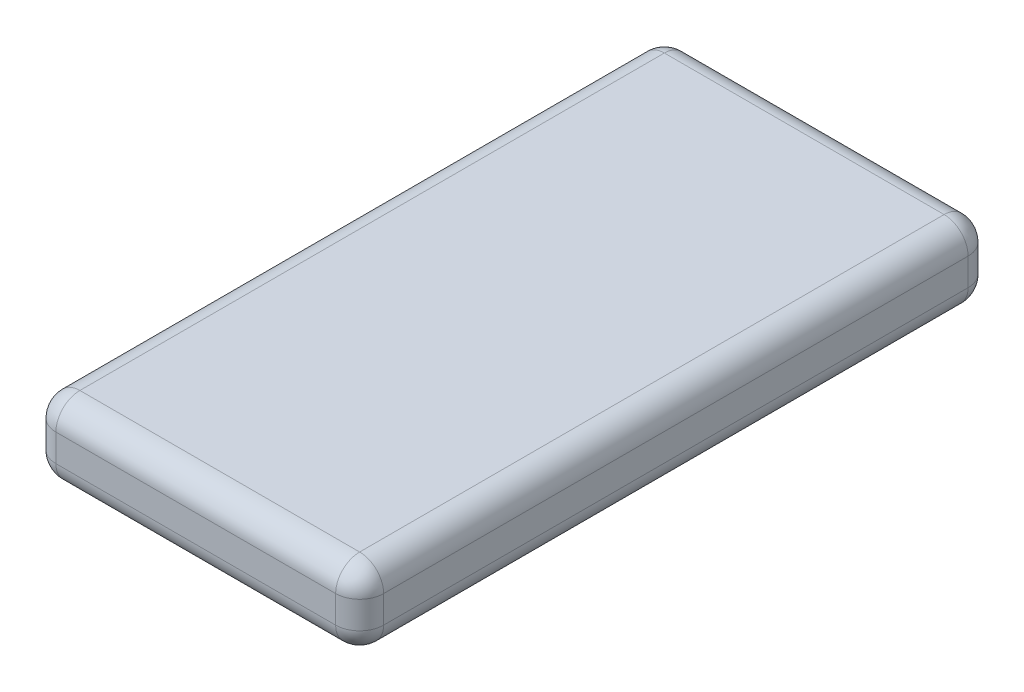
from build123d import *

# Parameters (mm, degrees)
SKETCH1_W           = 68.3
SKETCH1_H           = 131.8
BOSS_EXTRUDE1_DEPTH = 7.85
FILLET1_R           = 5
SKETCH2_W           = 10
SKETCH2_H           = 10
CUT_EXTRUDE1_DEPTH  = 10


with BuildPart() as part:
    # Sketch1 → Boss-Extrude1 (new, symmetric)
    with BuildSketch(Plane(origin=(0, 0, 0), x_dir=(1, 0, 0), z_dir=(0, 1, 0))):
        Rectangle(SKETCH1_W, SKETCH1_H)
    extrude(amount=BOSS_EXTRUDE1_DEPTH, both=True)

    # Fillet1
    fillet1_edges = [part.edges().sort_by_distance(p)[0] for p in [
        (0, -7.85, -65.9),
        (0, -7.85, 65.9),
        (0, 7.85, 65.9),
        (0, 7.85, -65.9),
        (34.15, 0, 65.9),
        (34.15, 7.85, 0),
        (34.15, 0, -65.9),
        (34.15, -7.85, 0),
        (-34.15, 0, -65.9),
        (-34.15, 7.85, 0),
        (-34.15, 0, 65.9),
        (-34.15, -7.85, 0),
    ]]
    fillet(fillet1_edges, radius=FILLET1_R)

    # Sketch2 → Cut-Extrude1 (cut)
    with BuildSketch(Plane(origin=(0, 0, -65.9), x_dir=(-1, 0, 0), z_dir=(0, 0, -1))):
        Rectangle(SKETCH2_W, SKETCH2_H)
    extrude(amount=-CUT_EXTRUDE1_DEPTH, mode=Mode.SUBTRACT)


solid = part.part
